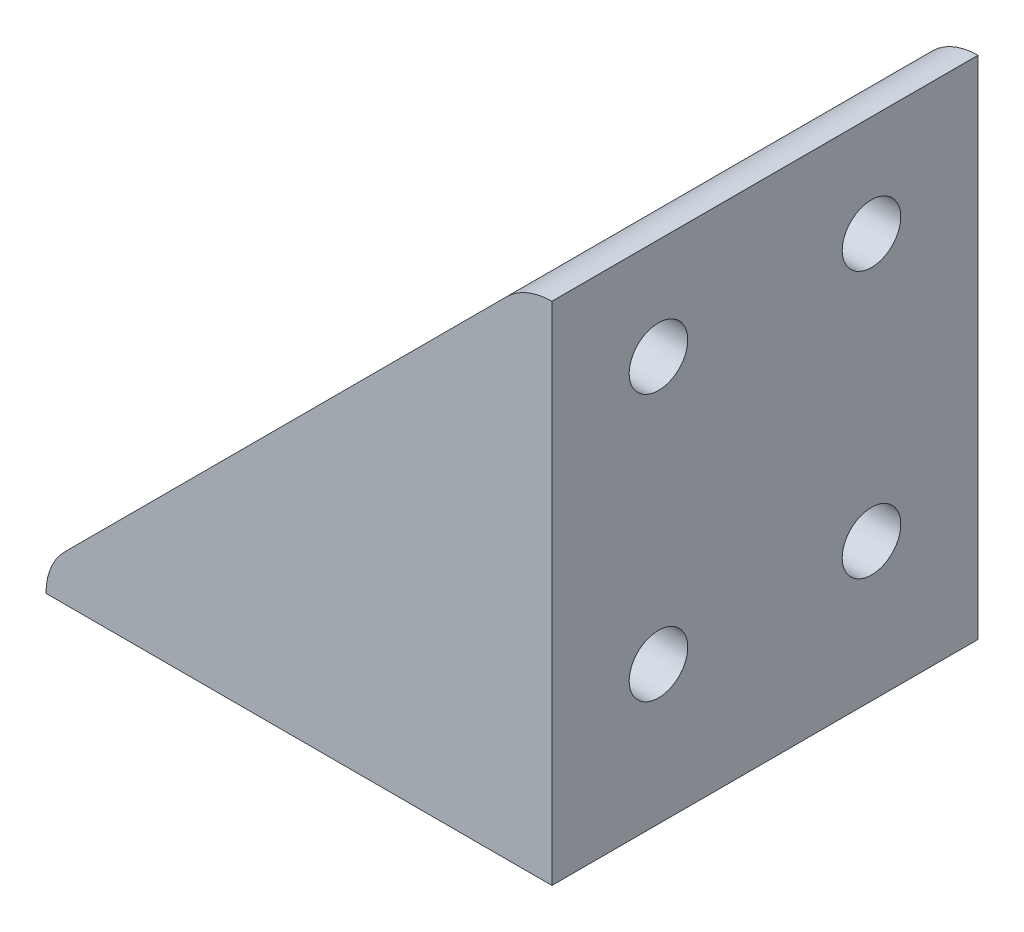
from build123d import *

# Parameters (mm, degrees)
SKETCH1_W                = 50
SKETCH1_H                = 40
BOSS_EXTRUDE1_DEPTH      = 50
CUT_EXTRUDE1_DEPTH       = 69.738635424
SHELL1_T                 = -5
M5_CLEARANCE_HOLE1_D     = 5.5
M5_CLEARANCE_HOLE1_DEPTH = 12
M5_CLEARANCE_HOLE1_TIP   = 1.652366702
CUT_EXTRUDE2_DEPTH       = 1
CUT_EXTRUDE3_DEPTH       = 1
CUT_EXTRUDE4_DEPTH       = 69.738635424
FILLET2_R                = 6
M5_CLEARANCE_HOLE2_D     = 5.5
M5_CLEARANCE_HOLE2_DEPTH = 12
M5_CLEARANCE_HOLE2_TIP   = 1.652366702
BOSS_EXTRUDE2_DEPTH      = 2
BOSS_EXTRUDE2_DEPTH_BACK = 2


with BuildPart() as part:
    # Sketch1 → Boss-Extrude1 (new body)
    with BuildSketch(Plane(origin=(0, 0, 0), x_dir=(1, 0, 0), z_dir=(0, 1, 0))):
        Rectangle(SKETCH1_W, SKETCH1_H)
    extrude(amount=BOSS_EXTRUDE1_DEPTH)

    # Sketch2 → Cut-Extrude1 (cut, through all)
    with BuildSketch(Plane.XY.offset(20)):
        Polygon((-25, 0), (25, 50), (-25, 50), align=None)
    extrude(amount=-CUT_EXTRUDE1_DEPTH, mode=Mode.SUBTRACT)

    # Shell1
    shell1_openings = [part.faces().sort_by_distance(p)[0] for p in [
        (0, 25, 0),
    ]]
    offset(amount=SHELL1_T, openings=shell1_openings, kind=Kind.INTERSECTION)

    # M5 Clearance Hole1
    with Locations(Plane.ZY.offset(-20)):
        with Locations((-10, 38), (-10, 13), (10, 13), (10, 38)):
            Hole(M5_CLEARANCE_HOLE1_D / 2, depth=M5_CLEARANCE_HOLE1_DEPTH)
            with Locations((0, 0, -(M5_CLEARANCE_HOLE1_DEPTH + M5_CLEARANCE_HOLE1_TIP / 2))):  # 118° drill point
                Cone(0, M5_CLEARANCE_HOLE1_D / 2, M5_CLEARANCE_HOLE1_TIP, mode=Mode.SUBTRACT)

    # Sketch5 → Cut-Extrude2 (cut)
    with BuildSketch(Plane.XY.offset(-15)):
        Polygon((-20, 5), (20, 5), (20, 45), align=None)
    extrude(amount=-CUT_EXTRUDE2_DEPTH, mode=Mode.SUBTRACT)

    # Sketch6 → Cut-Extrude3 (cut)
    with BuildSketch(Plane(origin=(0, 0, 15), x_dir=(-1, 0, 0), z_dir=(0, 0, -1))):
        Polygon((-20, 45), (-20, 5), (20, 5), align=None)
    extrude(amount=-CUT_EXTRUDE3_DEPTH, mode=Mode.SUBTRACT)

    # Sketch7 → Cut-Extrude4 (cut, through all)
    with BuildSketch(Plane.XY.offset(20)):
        Polygon((-22.5, 2.5), (-22.5, 0), (-25, 0), align=None)
        Polygon((22.5, 47.5), (25, 47.5), (25, 50), align=None)
    extrude(amount=-CUT_EXTRUDE4_DEPTH, mode=Mode.SUBTRACT)

    # Fillet2
    fillet2_edges = [part.edges().sort_by_distance(p)[0] for p in [
        (-22.5, 2.5, 0),
        (22.5, 47.5, 0),
    ]]
    fillet(fillet2_edges, radius=FILLET2_R)

    # M5 Clearance Hole2
    with Locations(Plane(origin=(0, 5, 0), x_dir=(1, 0, 0), z_dir=(0, 1, 0))):
        with Locations((12, 10), (12, -10), (-13, 10), (-13, -10)):
            Hole(M5_CLEARANCE_HOLE2_D / 2, depth=M5_CLEARANCE_HOLE2_DEPTH)
            with Locations((0, 0, -(M5_CLEARANCE_HOLE2_DEPTH + M5_CLEARANCE_HOLE2_TIP / 2))):  # 118° drill point
                Cone(0, M5_CLEARANCE_HOLE2_D / 2, M5_CLEARANCE_HOLE2_TIP, mode=Mode.SUBTRACT)

    # Sketch10 → Boss-Extrude2 (add, two sides: drawn at the far end of the back side and taken through both)
    with BuildSketch(Plane.XY.offset(-BOSS_EXTRUDE2_DEPTH_BACK)):
        Polygon((20, 5), (20, 45), (-20, 5), align=None)
    extrude(amount=BOSS_EXTRUDE2_DEPTH + BOSS_EXTRUDE2_DEPTH_BACK)


solid = part.part
